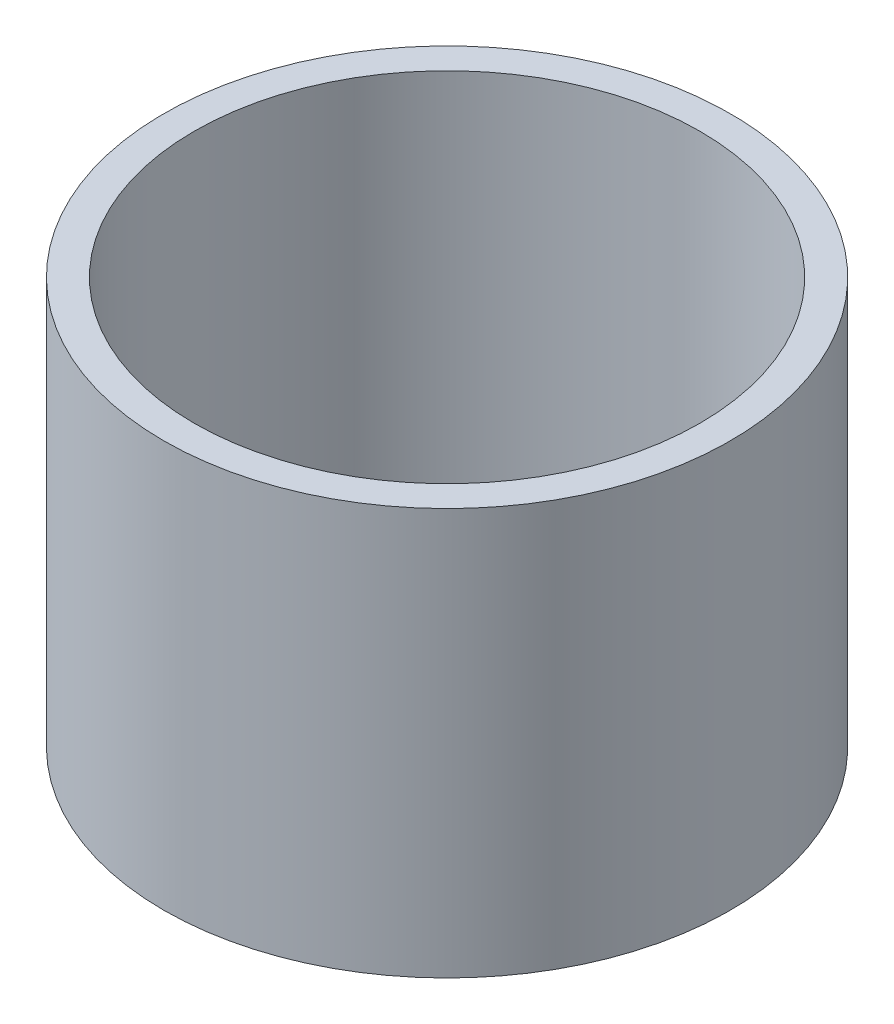
from build123d import *

# Parameters (mm, degrees)
SKETCH1_R           = 42.5
BOSS_EXTRUDE1_DEPTH = 60.987292348
SKETCH2_R           = 37.939240809
CUT_EXTRUDE1_DEPTH  = 86.626805545


with BuildPart() as part:
    # Sketch1 → Boss-Extrude1 (new body)
    with BuildSketch(Plane(origin=(0, 0, 0), x_dir=(1, 0, 0), z_dir=(0, 1, 0))):
        Circle(SKETCH1_R)
    extrude(amount=BOSS_EXTRUDE1_DEPTH)

    # Sketch2 → Cut-Extrude1 (cut, through all)
    with BuildSketch(Plane(origin=(0, 0, 0), x_dir=(1, 0, 0), z_dir=(0, 1, 0))):
        Circle(SKETCH2_R)
    extrude(amount=CUT_EXTRUDE1_DEPTH, mode=Mode.SUBTRACT)


solid = part.part
